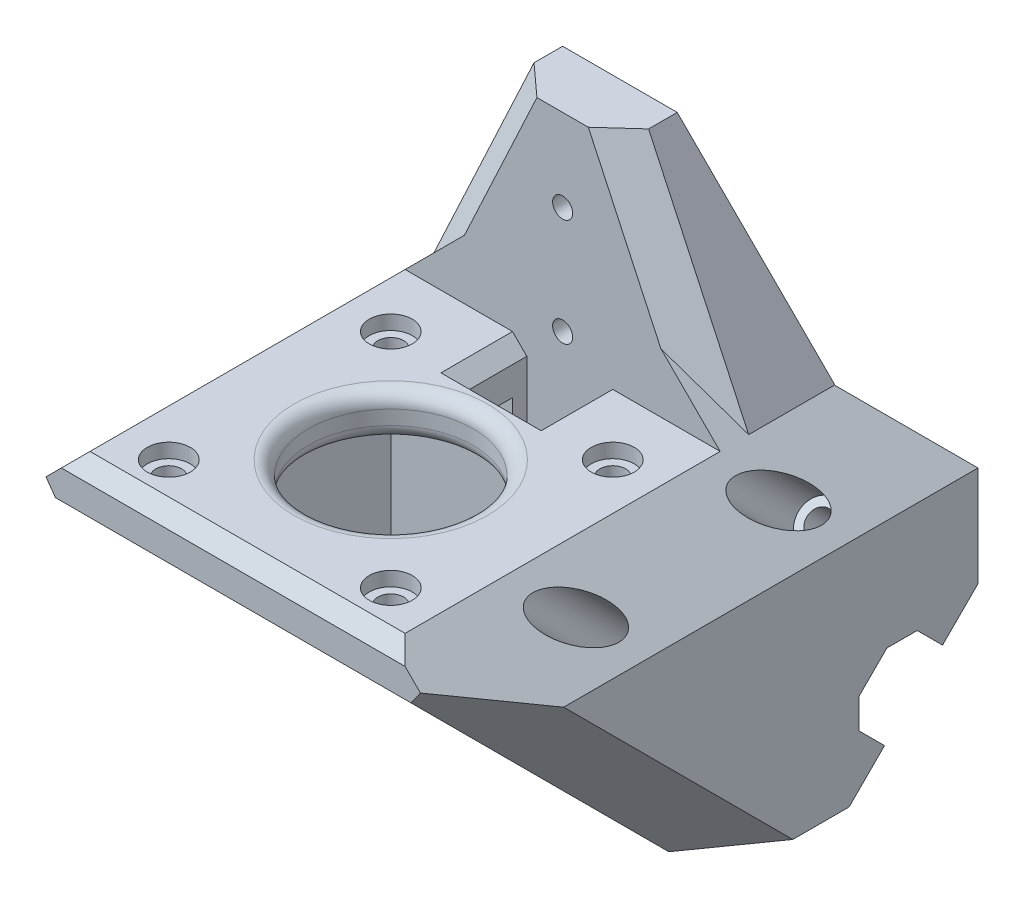
from build123d import *

# Parameters (mm, degrees)
SKETCH1_W           = 28
SKETCH1_H           = 28
BOSS_EXTRUDE1_DEPTH = 64
CHAMFER1_SIZE       = 18
SKETCH3_W           = 64
SKETCH3_H           = 28
BOSS_EXTRUDE2_DEPTH = 14
BOSS_EXTRUDE3_DEPTH = 44
CHAMFER2_SIZE       = 32
SKETCH5_R           = 11.5
SKETCH5_R_2         = 1.8
CUT_EXTRUDE1_DEPTH  = 6
CHAMFER3_SIZE       = 2
SKETCH2_R           = 1.8
CUT_EXTRUDE2_DEPTH  = 96.676538399
SKETCH6_R           = 3
CUT_EXTRUDE3_DEPTH  = 45
SKETCH7_R           = 3
CUT_EXTRUDE4_DEPTH  = 2
FILLET1_R           = 2
CHAMFER4_SIZE       = 10
CHAMFER5_SIZE       = 10
CHAMFER6_START      = -29
CHAMFER6_OUTLINE_W  = 4
CHAMFER6_OUTLINE_H  = 54
CHAMFER6_DEPTH      = 3.544155877
CHAMFER7_SIZE       = 10
SKETCH8_W           = 44
SKETCH8_H           = 16
BOSS_EXTRUDE4_DEPTH = 30
SKETCH9_R           = 1.4
CUT_EXTRUDE5_DEPTH  = 3.5
CHAMFER8_SIZE       = 14
CHAMFER8_SIZE_2     = 30.023096887
CHAMFER9_SIZE       = 8
CHAMFER9_SIZE2      = 29.856406461
CHAMFER10_SIZE      = 4
SKETCH11_W          = 10
SKETCH11_H          = 8
CUT_EXTRUDE6_DEPTH  = 97.041657628
CHAMFER11_SIZE      = 2
SKETCH12_W          = 64
SKETCH12_H          = 11.455844122
CUT_EXTRUDE7_DEPTH  = 8
CHAMFER12_SIZE      = 3


with BuildPart() as part:
    # Sketch1 → Boss-Extrude1 (new body)
    with BuildSketch(Plane(origin=(0, 0, 0), x_dir=(0, 0, -1), z_dir=(1, 0, 0))):
        Rectangle(SKETCH1_W, SKETCH1_H)
    extrude(amount=BOSS_EXTRUDE1_DEPTH)

    # Chamfer1
    chamfer1_edges = [part.edges().sort_by_distance(p)[0] for p in [
        (32, -14, -14),
    ]]
    chamfer(chamfer1_edges, length=CHAMFER1_SIZE)

    # Sketch3 → Boss-Extrude2 (add)
    with BuildSketch(Plane(origin=(0, 14, 0), x_dir=(1, 0, 0), z_dir=(0, 1, 0))):
        with Locations((32, 0)):
            Rectangle(SKETCH3_W, SKETCH3_H)
    extrude(amount=BOSS_EXTRUDE2_DEPTH)

    # Sketch4 → Boss-Extrude3 (add)
    with BuildSketch(Plane.XY.offset(14)):
        Polygon((0, -14), (0, 28), (64, 28), (64, -14), (54, -14), (54, 22), (10, 22), (10, -14), align=None)
    extrude(amount=BOSS_EXTRUDE3_DEPTH)

    # Chamfer2
    chamfer2_edges = [part.edges().sort_by_distance(p)[0] for p in [
        (5, -14, 58),
        (59, -14, 58),
    ]]
    chamfer(chamfer2_edges, length=CHAMFER2_SIZE)

    # Sketch5 → Cut-Extrude1 (cut)
    with BuildSketch(Plane(origin=(0, 22, 0), x_dir=(-1, 0, 0), z_dir=(0, -1, 0))):
        with Locations(Location((-32, -36, 0), (0, 0, 180))):
            Circle(SKETCH5_R)
        with Locations(Location((-16.5, -51.5, 0), (0, 0, 180))):
            Circle(SKETCH5_R_2)
        with Locations(Location((-47.5, -51.5, 0), (0, 0, 180))):
            Circle(SKETCH5_R_2)
        with Locations(Location((-47.5, -20.5, 0), (0, 0, 180))):
            Circle(SKETCH5_R_2)
        with Locations(Location((-16.5, -20.5, 0), (0, 0, 180))):
            Circle(SKETCH5_R_2)
    extrude(amount=-CUT_EXTRUDE1_DEPTH, mode=Mode.SUBTRACT)

    # Chamfer3
    chamfer3_edges = [part.edges().sort_by_distance(p)[0] for p in [
        (32, 28, 58),
    ]]
    chamfer(chamfer3_edges, length=CHAMFER3_SIZE)

    # Sketch2 → Cut-Extrude2 (cut, through all)
    with BuildSketch(Plane(origin=(0, -5, -5), x_dir=(-1, 0, 0), z_dir=(0, -0.7071067811865488, -0.7071067811865464))):
        with Locations(Location((-5, -10, 0), (0, 0, 90))):
            Circle(SKETCH2_R)
        with Locations(Location((-59, -10, 0), (0, 0, 90))):
            Circle(SKETCH2_R)
        with Locations(Location((-59, 10, 0), (0, 0, 90))):
            Circle(SKETCH2_R)
        with Locations(Location((-5, 10, 0), (0, 0, 90))):
            Circle(SKETCH2_R)
    extrude(amount=-CUT_EXTRUDE2_DEPTH, mode=Mode.SUBTRACT)

    # Sketch6 → Cut-Extrude3 (cut)
    with BuildSketch(Plane(origin=(0, 42, 42), x_dir=(1, 0, 0), z_dir=(0, 0.7071067811865477, 0.7071067811865475))):
        with Locations(Location((5, -10, 0), (0, 0, 270))):
            Circle(SKETCH6_R)
        with Locations(Location((5, 10, 0), (0, 0, 270))):
            Circle(SKETCH6_R)
        with Locations(Location((59, 10, 0), (0, 0, 270))):
            Circle(SKETCH6_R)
        with Locations(Location((59, -10, 0), (0, 0, 270))):
            Circle(SKETCH6_R)
    extrude(amount=-CUT_EXTRUDE3_DEPTH, mode=Mode.SUBTRACT)

    # Sketch7 → Cut-Extrude4 (cut)
    with BuildSketch(Plane(origin=(0, 28, 0), x_dir=(1, 0, 0), z_dir=(0, 1, 0))):
        with Locations(Location((16.5, -20.5, 0), (0, 0, 270))):
            Circle(SKETCH7_R)
        with Locations(Location((47.5, -20.5, 0), (0, 0, 270))):
            Circle(SKETCH7_R)
        with Locations(Location((47.5, -51.5, 0), (0, 0, 270))):
            Circle(SKETCH7_R)
        with Locations(Location((16.5, -51.5, 0), (0, 0, 270))):
            Circle(SKETCH7_R)
    extrude(amount=-CUT_EXTRUDE4_DEPTH, mode=Mode.SUBTRACT)

    # Fillet1
    fillet1_edges = [part.edges().sort_by_distance(p)[0] for p in [
        (20.5, 28, 36),
        (20.5, 22, 36),
    ]]
    fillet(fillet1_edges, radius=FILLET1_R)

    # Chamfer4
    # the kernel refuses this chamfer: 10 mm, written as the material it takes off along each edge
    with BuildSketch(Plane(origin=(64, 28, 81.71682988), x_dir=(-1, 0, 0), z_dir=(0, 0, -1))) as chamfer4_piece_1:
        Polygon((CHAMFER4_SIZE, 0), (0, -CHAMFER4_SIZE), (0, 0), align=None)
    extrude(amount=121.433659759, mode=Mode.SUBTRACT)
    with BuildSketch(Plane(origin=(0, 28, 81.71682988), x_dir=(1, 0, 0), z_dir=(0, 0, -1))) as chamfer4_piece_2:
        Polygon((CHAMFER4_SIZE, 0), (0, CHAMFER4_SIZE), (0, 0), align=None)
    extrude(amount=121.433659759, mode=Mode.SUBTRACT)

    # Chamfer5
    chamfer5_edges = [part.edges().sort_by_distance(p)[0] for p in [
        (64, 2, 42),
        (0, 2, 42),
    ]]
    chamfer(chamfer5_edges, length=CHAMFER5_SIZE - 0.0001)  # a hair under: the kernel refuses the full size

    # Chamfer6: read off the stored shape, not the designer's step
    # Chamfer6 outline → Chamfer6 (cut)
    with BuildSketch(Plane(origin=(0, 0, 0), x_dir=(1, 0, 0), z_dir=(0, 0.707106781186549, -0.707106781186546)).offset(CHAMFER6_START)):
        with Locations((8, -31)):
            Rectangle(CHAMFER6_OUTLINE_W, CHAMFER6_OUTLINE_H)
        with Locations((56, -31)):
            Rectangle(CHAMFER6_OUTLINE_W, CHAMFER6_OUTLINE_H)
    extrude(amount=CHAMFER6_DEPTH, mode=Mode.SUBTRACT)

    # Chamfer7
    chamfer7_edges = [part.edges().sort_by_distance(p)[0] for p in [
        (32, 28, -14),
    ]]
    chamfer(chamfer7_edges, length=CHAMFER7_SIZE)

    # Sketch8 → Boss-Extrude4 (add)
    with BuildSketch(Plane(origin=(0, 28, 0), x_dir=(1, 0, 0), z_dir=(0, 1, 0))):
        with Locations((32, -4)):
            Rectangle(SKETCH8_W, SKETCH8_H)
    extrude(amount=BOSS_EXTRUDE4_DEPTH)

    # Sketch9 → Cut-Extrude5 (cut)
    with BuildSketch(Plane.XY.offset(12)):
        with Locations((32, 31.5)):
            Circle(SKETCH9_R)
        with Locations((32, 46.5)):
            Circle(SKETCH9_R)
    extrude(amount=-CUT_EXTRUDE5_DEPTH, mode=Mode.SUBTRACT)

    # Chamfer8
    # the kernel refuses this chamfer: 30.023096887, 14 mm, written as the material it takes off along each edge
    with BuildSketch(Plane(origin=(54, 58, -81.789107611), x_dir=(-1, 0, 0), z_dir=(0, 0, 1))) as chamfer8_piece_1_section:
        Polygon((CHAMFER8_SIZE, 0), (0, CHAMFER8_SIZE_2), (0, 0), align=None)
    chamfer8_piece_1 = extrude(amount=171.578215221, mode=Mode.PRIVATE)
    chamfer8_piece_1 = split(chamfer8_piece_1, bisect_by=Plane(origin=(39, 43, -81.789107611), z_dir=(0.7071067811865476, 0.7071067811865476, 0)), keep=Keep.TOP, mode=Mode.PRIVATE)
    add(chamfer8_piece_1, mode=Mode.SUBTRACT)
    with BuildSketch(Plane(origin=(10, 58, 89.789107611), x_dir=(0, -1, 0), z_dir=(0, 0, -1))) as chamfer8_piece_2_section:
        Polygon((CHAMFER8_SIZE_2, 0), (0, -CHAMFER8_SIZE), (0, 0), align=None)
    chamfer8_piece_2 = extrude(amount=171.578215221, mode=Mode.PRIVATE)
    chamfer8_piece_2 = split(chamfer8_piece_2, bisect_by=Plane(origin=(25, 43, 89.789107611), z_dir=(-0.7071067811865476, 0.7071067811865476, 0)), keep=Keep.TOP, mode=Mode.PRIVATE)
    add(chamfer8_piece_2, mode=Mode.SUBTRACT)

    # Chamfer9
    chamfer9_edges = [part.edges().sort_by_distance(p)[0] for p in [
        (32, 58, -4),
    ]]
    chamfer9_side = [part.faces().sort_by_distance(p)[0] for p in [
        (32, 58, 4),
    ]]
    chamfer(chamfer9_edges, length=CHAMFER9_SIZE, length2=CHAMFER9_SIZE2, reference=chamfer9_side[0])

    # Chamfer10
    chamfer10_edges = [part.edges().sort_by_distance(p)[0] for p in [
        (17.010090322, 43.010090322, 12),
        (46.989909678, 43.010090322, 12),
    ]]
    chamfer(chamfer10_edges, length=CHAMFER10_SIZE)

    # Sketch11 → Cut-Extrude6 (cut, through all)
    with BuildSketch(Plane(origin=(0, 28, 0), x_dir=(1, 0, 0), z_dir=(0, 1, 0))):
        with Locations((32, -16)):
            Rectangle(SKETCH11_W, SKETCH11_H)
    extrude(amount=-CUT_EXTRUDE6_DEPTH, mode=Mode.SUBTRACT)

    # Chamfer11
    chamfer11_edges = [part.edges().sort_by_distance(p)[0] for p in [
        (27, 28, 16),
        (32, 28, 20),
        (37, 28, 16),
    ]]
    chamfer(chamfer11_edges, length=CHAMFER11_SIZE)

    # Sketch12 → Cut-Extrude7 (cut)
    with BuildSketch(Plane(origin=(0, -5, -5), x_dir=(-1, 0, 0), z_dir=(0, -0.7071067811865488, -0.7071067811865464))):
        with Locations((-32, 0)):
            Rectangle(SKETCH12_W, SKETCH12_H)
    extrude(amount=-CUT_EXTRUDE7_DEPTH, mode=Mode.SUBTRACT)

    # Chamfer12
    chamfer12_edges = [part.edges().sort_by_distance(p)[0] for p in [
        (32, -3.393398282, 4.707106781),
        (32, 4.707106781, -3.393398282),
    ]]
    chamfer(chamfer12_edges, length=CHAMFER12_SIZE)


solid = part.part
